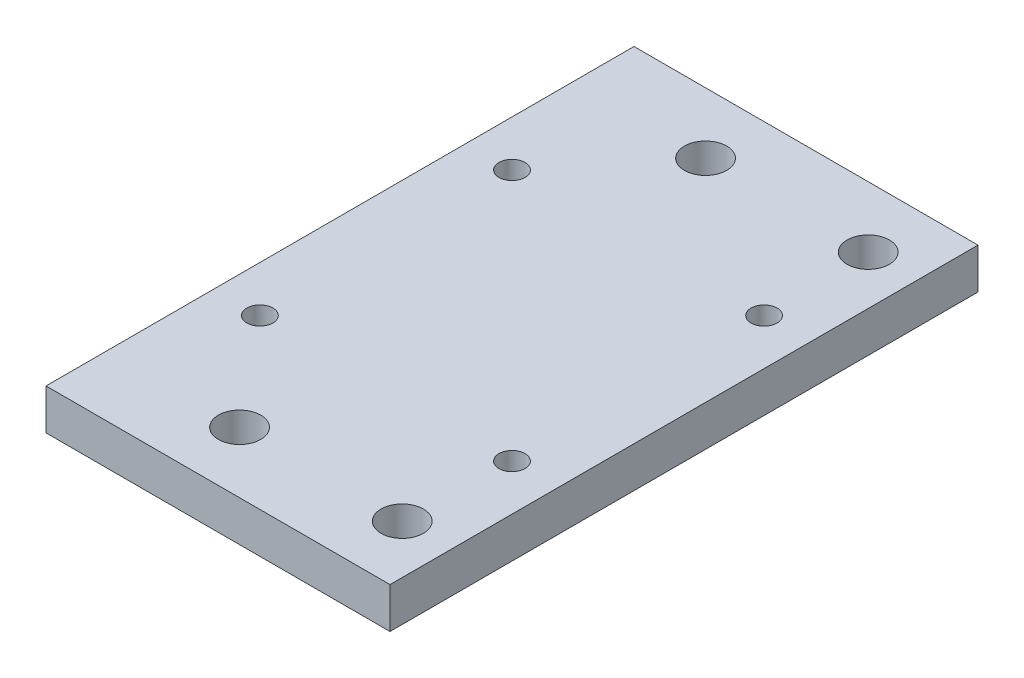
from build123d import *

# Parameters (mm, degrees)
SKETCH2_W           = 42.3
SKETCH2_H           = 72.3
SKETCH2_R           = 1.6
SKETCH2_R_2         = 2.6
BOSS_EXTRUDE1_DEPTH = 5


with BuildPart() as part:
    # Sketch2 → Boss-Extrude1 (new body)
    with BuildSketch(Plane(origin=(0, 0, 0), x_dir=(1, 0, 0), z_dir=(0, 1, 0))):
        Rectangle(SKETCH2_W, SKETCH2_H)
        with Locations((-15.5, -15.5)):
            Circle(SKETCH2_R, mode=Mode.SUBTRACT)
        with Locations((15.5, -15.5)):
            Circle(SKETCH2_R, mode=Mode.SUBTRACT)
        with Locations((-15.5, 15.5)):
            Circle(SKETCH2_R, mode=Mode.SUBTRACT)
        with Locations((15.5, 15.5)):
            Circle(SKETCH2_R, mode=Mode.SUBTRACT)
        with Locations((15.15, 28.65)):
            Circle(SKETCH2_R_2, mode=Mode.SUBTRACT)
        with Locations((-4.85, 28.65)):
            Circle(SKETCH2_R_2, mode=Mode.SUBTRACT)
        with Locations((15.15, -28.65)):
            Circle(SKETCH2_R_2, mode=Mode.SUBTRACT)
        with Locations((-4.85, -28.65)):
            Circle(SKETCH2_R_2, mode=Mode.SUBTRACT)
    extrude(amount=BOSS_EXTRUDE1_DEPTH)


solid = part.part
